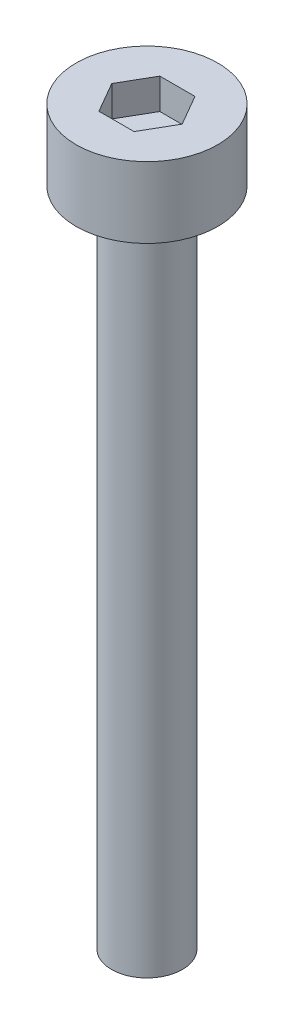
from build123d import *

# Parameters (mm, degrees)
SKETCH1_R           = 1.5
SCREWSHAFT_DEPTH    = 28
SKETCH2_R           = 3
BOSS_EXTRUDE2_DEPTH = 3
CUT_EXTRUDE1_DEPTH  = 1.3


with BuildPart() as part:
    # Sketch1 → ScrewShaft (new body)
    with BuildSketch(Plane(origin=(0, 0, 0), x_dir=(1, 0, 0), z_dir=(0, 1, 0))):
        Circle(SKETCH1_R)
    extrude(amount=SCREWSHAFT_DEPTH)

    # Sketch2 → Boss-Extrude2 (add)
    with BuildSketch(Plane(origin=(0, 28, 0), x_dir=(1, 0, 0), z_dir=(0, 1, 0))):
        Circle(SKETCH2_R)
    extrude(amount=BOSS_EXTRUDE2_DEPTH)

    # Sketch3 → Cut-Extrude1 (cut)
    with BuildSketch(Plane(origin=(0, 31, 0), x_dir=(1, 0, 0), z_dir=(0, 1, 0))):
        Polygon((1.489563695, 0), (0.744781847, 1.29), (-0.744781847, 1.29), (-1.489563695, 0), (-0.744781847, -1.29), (0.744781847, -1.29), align=None)
    extrude(amount=-CUT_EXTRUDE1_DEPTH, mode=Mode.SUBTRACT)


solid = part.part
